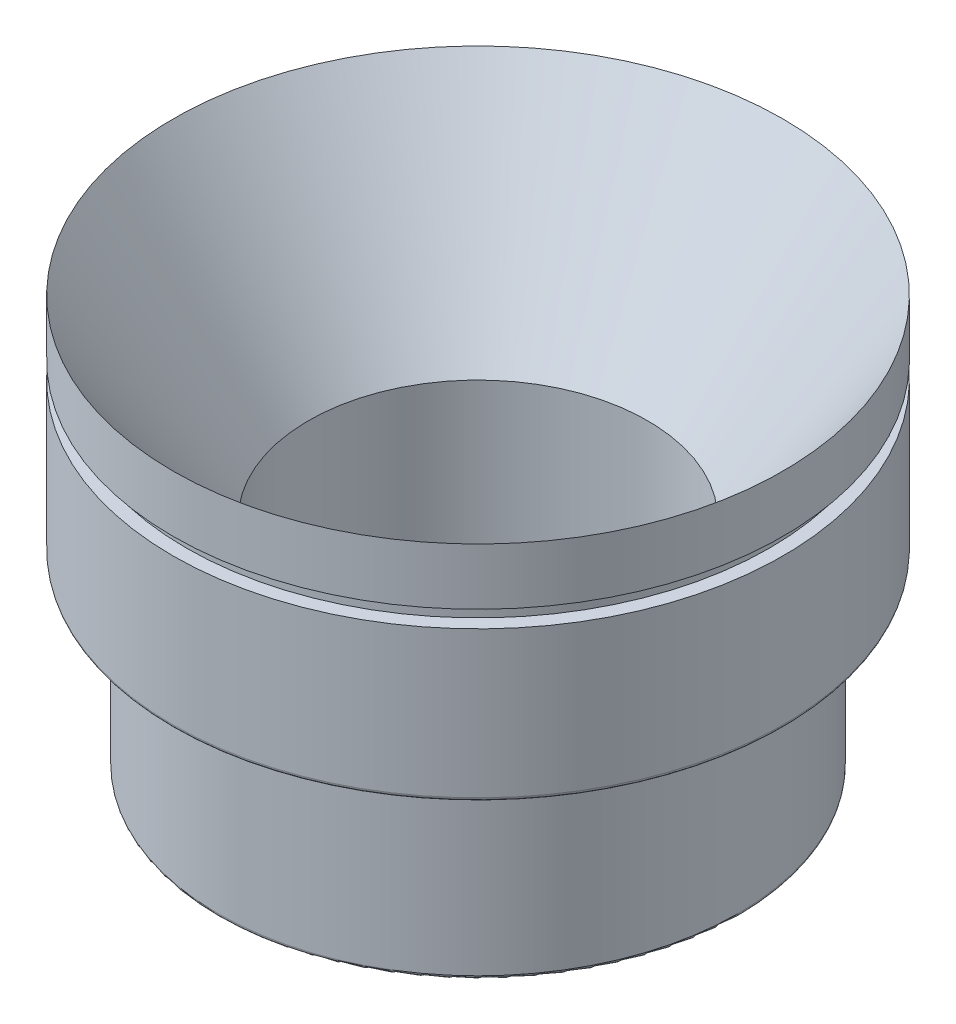
from build123d import *

# Parameters (mm, degrees)
SKETCH6_W     = 1.5113
SKETCH6_H     = 1.905
TOOL_RADIUS_R = 0.4064


with BuildPart() as part:
    # Sketch4 → Revolve1 (revolve)
    with BuildSketch(Plane(origin=(0, 0, 0), x_dir=(0, 0, -1), z_dir=(1, 0, 0))):
        Polygon((34.2773, 0), (19.05, -21.746838143), (19.05, -38.149257502), (20.382233443, -46.030856842), (29.1846, -46.030856842), (29.1846, -25.101256842), (34.2773, -25.101256842), align=None)
    revolve(axis=Axis((0, 0, 0), (0, -1, 0)))

    # Sketch6 → Spring Groove (revolve, cut)
    with BuildSketch(Plane(origin=(0, 0, 0), x_dir=(0, 0, -1), z_dir=(1, 0, 0))):
        with Locations((33.52165, -7.3025)):
            Rectangle(SKETCH6_W, SKETCH6_H)
    revolve(axis=Axis((0, 11.364369063, 0), (0, -1, 0)), mode=Mode.SUBTRACT)

    # Tool Radius
    tool_radius_edges = [part.edges().sort_by_distance(p)[0] for p in [
        (0, -46.030856842, 29.1846),
        (0, -25.101256842, 34.2773),
    ]]
    fillet(tool_radius_edges, radius=TOOL_RADIUS_R)


solid = part.part
